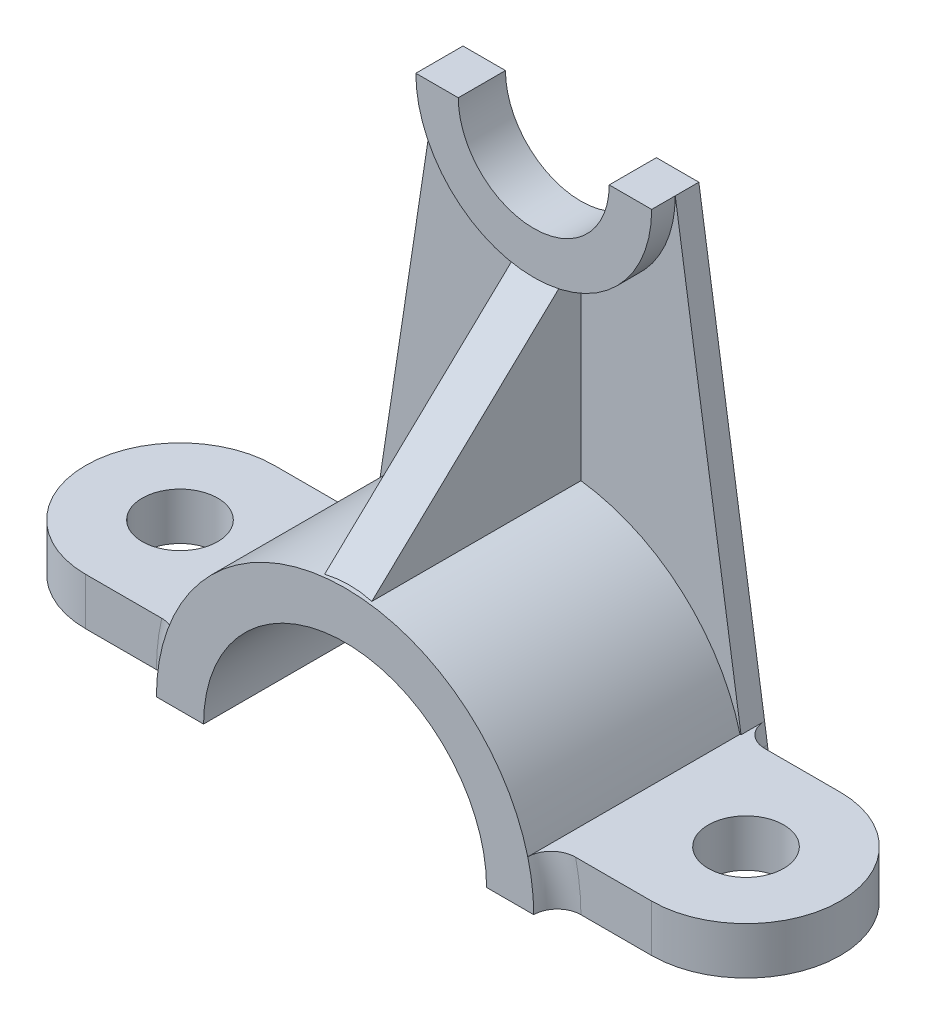
from build123d import *

# Parameters (mm, degrees)
EXTRUDE_THIN1_DEPTH         = 50
BOSS_EXTRUDE1_DEPTH         = 5
EXTRUDE_THIN3_DEPTH         = 5
EXTRUDE_THIN3_DEPTH_BACK    = 5
RIB6_REACH                  = 122.433
SKETCH4_WALL_W              = 296.6238277
SKETCH4_WALL_H              = 10
SKETCH5_W                   = 50
SKETCH5_H                   = 40
BOSS_EXTRUDE2_DEPTH         = 10
FILLET1_RADIUS              = 20
FILLET1_LENGTH              = 10
SKETCH6_R                   = 8
CUT_EXTRUDE1_DEPTH          = 132.77253128
FILLET2_R                   = 5
FILLET1_OF_MIRROR1_2_RADIUS = 20
FILLET1_OF_MIRROR1_2_LENGTH = 10
FILLET2_OF_MIRROR1_R        = 5


with BuildPart() as part:
    # Sketch1 → Extrude-Thin1 (new body)
    with BuildSketch(Plane.XY):
        with BuildLine():
            ThreePointArc((40, 0), (0, 40), (-40, 0))
            Line((-40, 0), (-30, 0))
            ThreePointArc((-30, 0), (0, 30), (30, 0))
            Line((30, 0), (40, 0))
        make_face()
    extrude(amount=EXTRUDE_THIN1_DEPTH)

    # Sketch2 → Boss-Extrude1 (add)
    with BuildSketch(Plane.XY):
        with BuildLine():
            Line((-30, 0), (-40, 0))
            ThreePointArc((-40, 0), (-39.886965034, 3.004999227), (-39.548498982, 5.993014955))
            Line((-39.548498982, 5.993014955), (-25, 102))
            ThreePointArc((-25, 102), (0, 77), (25, 102))
            Line((25, 102), (39.548498982, 5.993014955))
            ThreePointArc((39.548498982, 5.993014955), (39.886965034, 3.004999227), (40, 0))
            Line((40, 0), (30, 0))
            ThreePointArc((30, 0), (0, 30), (-30, 0))
        make_face()
    extrude(amount=BOSS_EXTRUDE1_DEPTH)

    # Sketch3 → Extrude-Thin3 (add, two sides: drawn at the far end of the back side and taken through both)
    with BuildSketch(Plane.XY.offset(5).offset(-EXTRUDE_THIN3_DEPTH_BACK)):
        with BuildLine():
            ThreePointArc((-25, 102), (0, 77), (25, 102))
            Line((25, 102), (16, 102))
            ThreePointArc((16, 102), (0, 86), (-16, 102))
            Line((-16, 102), (-25, 102))
        make_face()
    extrude(amount=EXTRUDE_THIN3_DEPTH + EXTRUDE_THIN3_DEPTH_BACK)

    # Sketch4 wall → Rib6 (add, up to next)
    with BuildSketch(Plane(origin=(0, 58.5, 29.5), x_dir=(0, -0.688260431919, 0.725463698509), z_dir=(0, -0.725463698509, -0.688260431919)), mode=Mode.PRIVATE) as rib6_sk1:
        Rectangle(SKETCH4_WALL_W, SKETCH4_WALL_H)
    rib6_tool1 = extrude(rib6_sk1.sketch, amount=RIB6_REACH, mode=Mode.PRIVATE) - part.part
    add(rib6_tool1.solids().sort_by_distance((0, 58.5, 29.5))[0])

    # Sketch5 → Boss-Extrude2 (add)
    with BuildSketch(Plane(origin=(0, 0, 0), x_dir=(1, 0, 0), z_dir=(0, 1, 0))):
        with Locations((55, -25)):
            Rectangle(SKETCH5_W, SKETCH5_H)
    boss_extrude2 = extrude(amount=BOSS_EXTRUDE2_DEPTH)

    # Fillet1: full round fillet: the end face becomes a half cylinder, R = half its width
    fillet1_face = Plane((80, 5, 25), x_dir=(0, 1, 0), z_dir=(1, 0, 0))  # on the end face: x along it, z out of the body
    fillet1_slab = fillet1_face.offset(-FILLET1_RADIUS / 2) * Box(FILLET1_LENGTH, 2 * FILLET1_RADIUS, FILLET1_RADIUS, mode=Mode.PRIVATE)  # the body's end, R deep
    fillet1_round = Plane((60, 5, 25), x_dir=(1, 0, 0), z_dir=(0, 1, 0)) * Cylinder(FILLET1_RADIUS, FILLET1_LENGTH, mode=Mode.PRIVATE)  # its axis R under the face
    add(fillet1_slab - fillet1_round, mode=Mode.SUBTRACT)

    # Sketch6 → Cut-Extrude1 (cut, through all)
    with BuildSketch(Plane(origin=(0, 10, 0), x_dir=(1, 0, 0), z_dir=(0, 1, 0))):
        with Locations(Location((60, -25, 0), (0, 0, 270))):
            Circle(SKETCH6_R)
    cut_extrude1 = extrude(amount=-CUT_EXTRUDE1_DEPTH, mode=Mode.SUBTRACT)

    # Fillet2
    fillet2_edges = [part.edges().sort_by_distance(p)[0] for p in [
        (39.244898063, 7.996507478, 5),
        (39.886965034, 3.004999227, 5),
        (39.681187851, 5.040171699, 45),
    ]]
    fillet(fillet2_edges, radius=FILLET2_R - 0.0001)  # a hair under: the kernel refuses the full size

    # Mirror1: Boss-Extrude2, Cut-Extrude1 across plane
    add(boss_extrude2.mirror(Plane(origin=(0, 0, 0), x_dir=(0, 0, 1), z_dir=(1, 0, 0))))
    add(cut_extrude1.mirror(Plane(origin=(0, 0, 0), x_dir=(0, 0, 1), z_dir=(1, 0, 0))), mode=Mode.SUBTRACT)

    # Fillet1 of Mirror1 2: full round fillet: the end face becomes a half cylinder, R = half its width
    fillet1_of_mirror1_2_face = Plane((-80, 5, 25), x_dir=(0, 1, 0), z_dir=(-1, 0, 0))  # on the end face: x along it, z out of the body
    fillet1_of_mirror1_2_slab = fillet1_of_mirror1_2_face.offset(-FILLET1_OF_MIRROR1_2_RADIUS / 2) * Box(FILLET1_OF_MIRROR1_2_LENGTH, 2 * FILLET1_OF_MIRROR1_2_RADIUS, FILLET1_OF_MIRROR1_2_RADIUS, mode=Mode.PRIVATE)  # the body's end, R deep
    fillet1_of_mirror1_2_round = Plane((-60, 5, 25), x_dir=(-1, 0, 0), z_dir=(0, 1, 0)) * Cylinder(FILLET1_OF_MIRROR1_2_RADIUS, FILLET1_OF_MIRROR1_2_LENGTH, mode=Mode.PRIVATE)  # its axis R under the face
    add(fillet1_of_mirror1_2_slab - fillet1_of_mirror1_2_round, mode=Mode.SUBTRACT)

    # Fillet2 of Mirror1
    fillet2_of_mirror1_edges = [part.edges().sort_by_distance(p)[0] for p in [
        (-39.244898063, 7.996507478, 5),
        (-39.886965034, 3.004999227, 5),
        (-39.681187851, 5.040171699, 45),
    ]]
    fillet(fillet2_of_mirror1_edges, radius=FILLET2_OF_MIRROR1_R - 0.0001)  # a hair under: the kernel refuses the full size


solid = part.part
